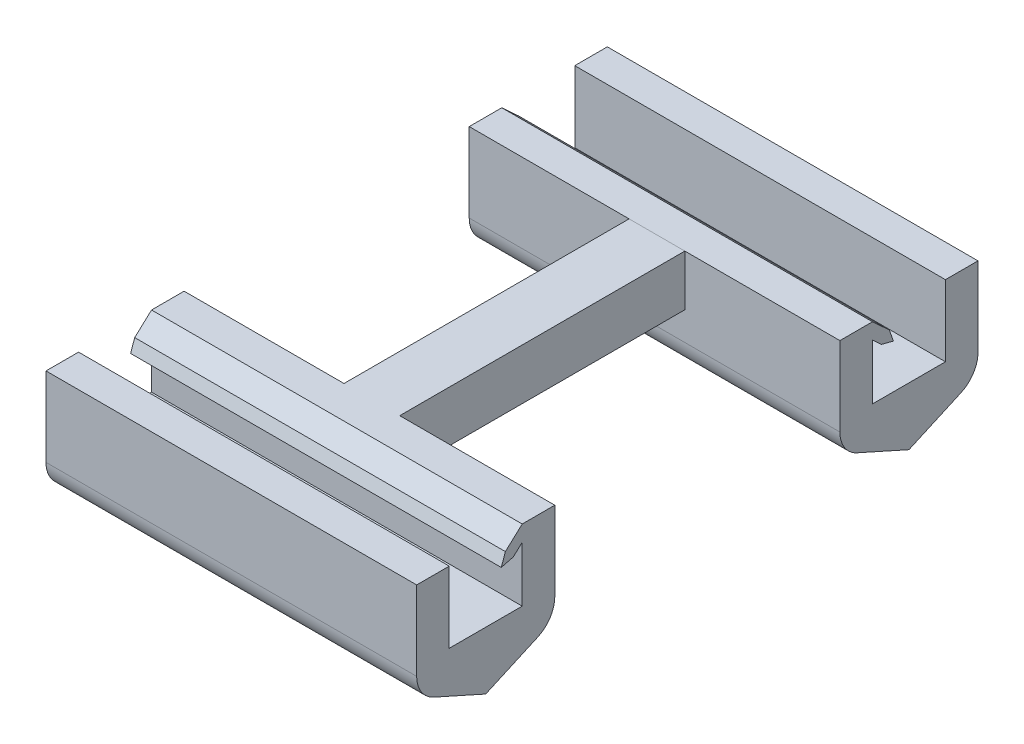
from build123d import *

# Parameters (mm, degrees)
BOSS_EXTRUDE1_DEPTH   = 12.7
BOSS_EXTRUDE1_2_DEPTH = 12.7
BOSS_EXTRUDE2_REACH   = 21.776


with BuildPart() as part:
    # Sketch1 → Boss-Extrude1 (new body)
    with BuildSketch(Plane(origin=(0, 0, 0), x_dir=(0, 0, -1), z_dir=(1, 0, 0))):
        with BuildLine():
            Line((6.30611145, -0.825095556), (6, -0.543502834))
            Line((6, -0.543502834), (6, -2.437418567))
            Line((6, -2.437418567), (8.5, -2.437418567))
            Line((8.5, -2.437418567), (8.5, 0))
            Line((8.5, 0), (9.615854332, 0))
            Line((9.615854332, 0), (9.615854332, -2.713473186))
            ThreePointArc((9.615854332, -2.713473186), (9.455087427, -3.257245023), (9.02447871, -3.62617583))
            Line((9.02447871, -3.62617583), (7.25, -4.420624343))
            Line((7.25, -4.420624343), (5.47552129, -3.62617583))
            ThreePointArc((5.47552129, -3.62617583), (5.044912573, -3.257245023), (4.884145668, -2.713473186))
            Line((4.884145668, -2.713473186), (4.884145668, 0))
            Line((4.884145668, 0), (6, 0))
            Line((6, 0), (6.576918535, -0.530708867))
            Line((6.576918535, -0.530708867), (6.717048019, -0.931365761))
            Line((6.717048019, -0.931365761), (6.30611145, -0.825095556))
        make_face()
    extrude(amount=BOSS_EXTRUDE1_DEPTH)


with BuildPart() as body_2:
    # Sketch1 → Boss-Extrude1 2 (new body)
    with BuildSketch(Plane(origin=(0, 0, 0), x_dir=(0, 0, -1), z_dir=(1, 0, 0))):
        with BuildLine():
            Line((-6, 0), (-4.884145668, 0))
            Line((-4.884145668, 0), (-4.884145668, -2.713473186))
            ThreePointArc((-4.884145668, -2.713473186), (-5.044912573, -3.257245023), (-5.47552129, -3.62617583))
            Line((-5.47552129, -3.62617583), (-7.25, -4.420624343))
            Line((-7.25, -4.420624343), (-9.02447871, -3.62617583))
            ThreePointArc((-9.02447871, -3.62617583), (-9.455087427, -3.257245023), (-9.615854332, -2.713473186))
            Line((-9.615854332, -2.713473186), (-9.615854332, 0))
            Line((-9.615854332, 0), (-8.5, 0))
            Line((-8.5, 0), (-8.5, -2.437418567))
            Line((-8.5, -2.437418567), (-6, -2.437418567))
            Line((-6, -2.437418567), (-6, -0.543502834))
            Line((-6, -0.543502834), (-6.30611145, -0.825095556))
            Line((-6.30611145, -0.825095556), (-6.717048019, -0.931365761))
            Line((-6.717048019, -0.931365761), (-6.576918535, -0.530708867))
            Line((-6.576918535, -0.530708867), (-6, 0))
        make_face()
    extrude(amount=BOSS_EXTRUDE1_2_DEPTH)

    # Sketch2 → Boss-Extrude2 (add, up to next)
    with BuildSketch(Plane.XY.offset(-4.884145668), mode=Mode.PRIVATE) as boss_extrude2_sk1:
        Polygon((5.47811731, 0), (7.387826905, 0), (7.387826905, -1.741683954), (6.432972108, -2.696538752), (5.47811731, -1.741683954), align=None)
    boss_extrude2_tool1 = extrude(boss_extrude2_sk1.sketch, amount=BOSS_EXTRUDE2_REACH, mode=Mode.PRIVATE) - body_2.part
    add(boss_extrude2_tool1.solids().sort_by_distance((6.432972, -1.126675, -4.884146))[0])


solid = Compound([part.part, body_2.part])
